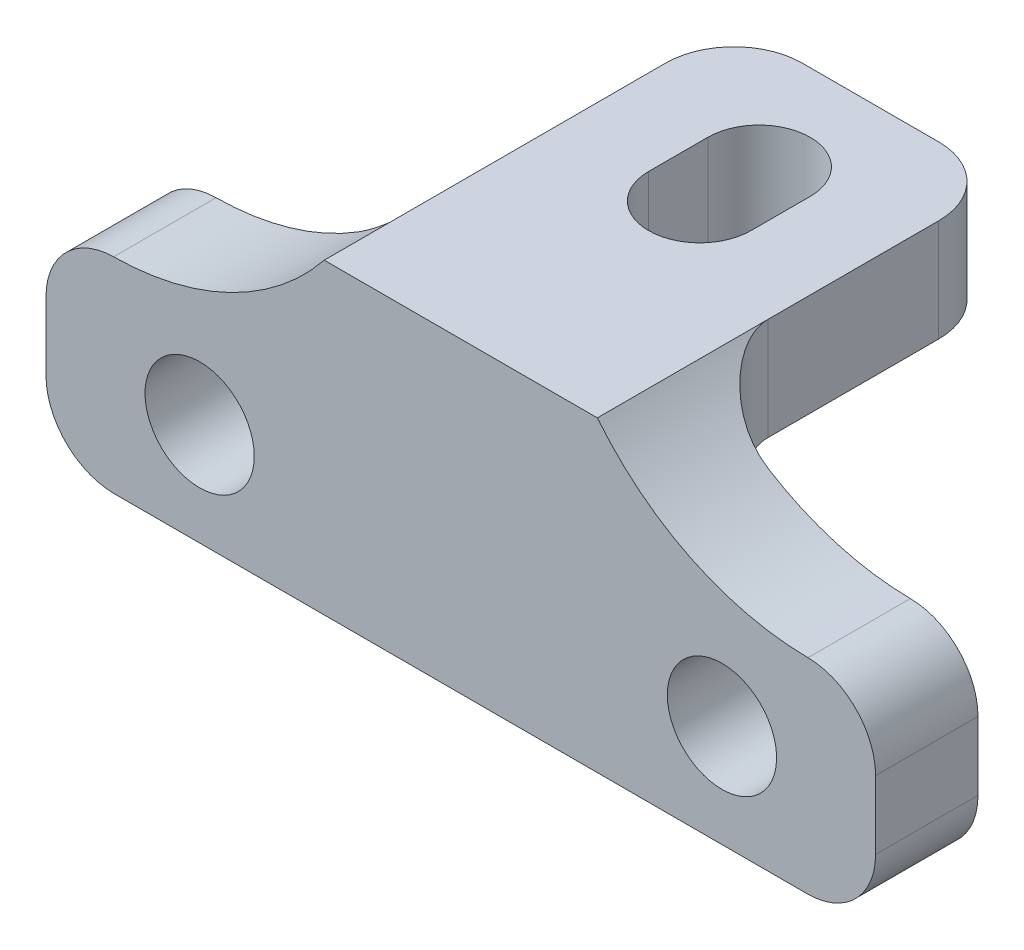
from build123d import *

# Parameters (mm, degrees)
ESBO_O1_W                = 24.3
ESBO_O1_H                = 6
ESBO_O1_R                = 1.6
FLANGE_BASE1_DEPTH       = 3
ESBO_O6_W                = 8
ESBO_O6_H                = 12
RESSALTO_EXTRUS_O1_DEPTH = 3
FILETE1_R                = 8
FILETE2_R                = 2


# Sheet-metal steps are written as plain solids
with BuildPart() as part:
    # Esboço1 → Flange-base1 (new body)
    with BuildSketch(Plane.XY):
        with Locations((-37.35698959, 21.652941176)):
            Rectangle(ESBO_O1_W, ESBO_O1_H)
        with Locations((-45.00698959, 21.652941176)):
            Circle(ESBO_O1_R, mode=Mode.SUBTRACT)
        with Locations(Location((-29.70698959, 21.652941176, 0), (0, 0, 180))):
            Circle(ESBO_O1_R, mode=Mode.SUBTRACT)
    extrude(amount=-FLANGE_BASE1_DEPTH)

    # Esboço6 → Ressalto-extrusão1 (add)
    with BuildSketch(Plane(origin=(0, 24.652941176, 0), x_dir=(1, 0, 0), z_dir=(0, 1, 0))):
        with Locations((-37.35698959, 6)):
            Rectangle(ESBO_O6_W, ESBO_O6_H)
        with BuildLine():
            Line((-35.85698959, 8.735419394), (-35.85698959, 7))
            ThreePointArc((-35.85698959, 7), (-37.35698959, 5.5), (-38.85698959, 7))
            Line((-38.85698959, 7), (-38.85698959, 8.735419394))
            ThreePointArc((-38.85698959, 8.735419394), (-37.35698959, 10.235419394), (-35.85698959, 8.735419394))
        make_face(mode=Mode.SUBTRACT)
    extrude(amount=RESSALTO_EXTRUS_O1_DEPTH)

    # Filete1
    # the kernel refuses this fillet: 8 mm, written as the material it adds along each edge
    with BuildSketch(Plane(origin=(-33.35698959, 24.652941176, 0), x_dir=(1, 0, 0), z_dir=(0, 0, -1)), Plane(origin=(-41.35698959, 24.652941176, -3), x_dir=(-1, 0, 0), z_dir=(0, 0, 1))) as filete1_piece_1:
        with BuildLine():
            CenterArc((6.244997998, -8), FILETE1_R, 90, 51.317812547)
            Line((0, -3), (0, 0))
            Line((0, 0), (6.244997998, 0))
        make_face()
    extrude(amount=3)

    # Filete2
    filete2_edges = [part.edges().sort_by_distance(p)[0] for p in [
        (-33.35698959, 26.152941176, -3),
        (-41.35698959, 26.152941176, -3),
        (-41.35698959, 26.152941176, -12),
        (-33.35698959, 26.152941176, -12),
        (-25.20698959, 24.652941176, -1.5),
        (-25.20698959, 18.652941176, -1.5),
        (-49.50698959, 24.652941176, -1.5),
        (-49.50698959, 18.652941176, -1.5),
        (-37.35698959, 24.652941176, -3),
    ]]
    fillet(filete2_edges, radius=FILETE2_R)


solid = part.part
